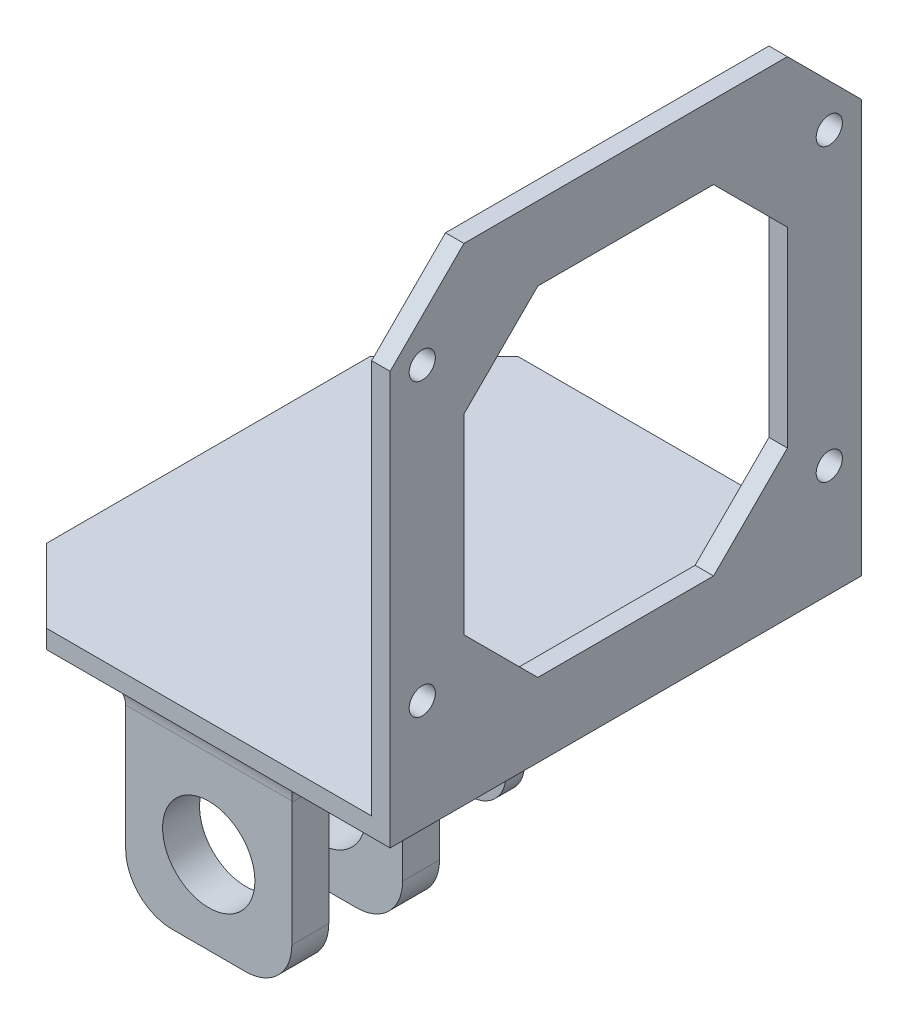
from build123d import *

# Parameters (mm, degrees)
SKETCH1_W            = 71.755
SKETCH1_H            = 81.026
BOSS_EXTRUDE1_DEPTH  = 3.175
BOSS_EXTRUDE4_DEPTH  = 80.51799999999999
BOSS_EXTRUDE10_START = -7.366
SKETCH8_R            = 3.174999999999998
BOSS_EXTRUDE10_DEPTH = 1.5875
FILLET1_R            = 6.35
FILLET2_R            = 8.466666666666665
CUT_EXTRUDE1_REACH   = 138.816
SKETCH9_W            = 55.626000000000005
SKETCH9_H            = 58.29299999999998
FILLET3_SIZE         = 12.7
CHAMFER1_SIZE        = 12.7
BOSS_EXTRUDE11_START = -11.03757
SKETCH10_R           = 7.937500000000002
BOSS_EXTRUDE11_DEPTH = 6.35
LPATTERN1_COUNT      = 2
LPATTERN1_PITCH      = 19.049999999999997
FILLET4_R            = 6.35
FILLET5_R            = 7.9375
CUT_EXTRUDE2_REACH   = 138.816
SKETCH13_R           = 2.2499999999999964
SKETCH13_R_2         = 2.2500000000000013


with BuildPart() as part:
    # Sketch1 → Boss-Extrude1 (new body)
    with BuildSketch(Plane(origin=(0, 0, 0), x_dir=(1, 0, 0), z_dir=(0, 1, 0))):
        with Locations((35.8775, 40.513)):
            Rectangle(SKETCH1_W, SKETCH1_H)
    extrude(amount=BOSS_EXTRUDE1_DEPTH)

    # Sketch3 → Boss-Extrude4 (add)
    with BuildSketch(Plane(origin=(0, 3.175, 0), x_dir=(1, 0, 0), z_dir=(0, 1, 0))):
        Polygon((71.755, 0), (68.58, -3.9e-16), (68.58, 81.026), (71.755, 81.026), align=None)
    extrude(amount=BOSS_EXTRUDE4_DEPTH)

    # Sketch8 → Boss-Extrude10 (add, symmetric)
    with BuildSketch(Plane.XY.offset(-40.513).offset(BOSS_EXTRUDE10_START)):
        Polygon((26.3525, 0), (26.352499999999996, -31.75), (45.4025, -31.75), (45.402499999999996, 0), align=None)
        with Locations((35.8775, -21.249999999999993)):
            Circle(SKETCH8_R, mode=Mode.SUBTRACT)
    extrude(amount=BOSS_EXTRUDE10_DEPTH, both=True)

    # Fillet1
    fillet1_edges = [part.edges().sort_by_distance(p)[0] for p in [
        (26.352499999999996, -31.75, -47.879),
        (45.4025, -31.75, -47.879),
    ]]
    fillet(fillet1_edges, radius=FILLET1_R)

    # Fillet2
    fillet2_edges = [part.edges().sort_by_distance(p)[0] for p in [
        (35.8775, 0, -49.466499999999996),
        (26.3525, 0, -47.879),
        (35.8775, 0, -46.2915),
        (45.402499999999996, 0, -47.879),
    ]]
    fillet(fillet2_edges, radius=FILLET2_R)

    # Sketch9 → Cut-Extrude1 (cut, up to next)
    with BuildSketch(Plane(origin=(71.755, 0, 0), x_dir=(0, 0, -1), z_dir=(1, 0, 0)), mode=Mode.PRIVATE) as cut_extrude1_sk1:
        with Locations((40.513000000000005, 41.84649999999999)):
            Rectangle(SKETCH9_W, SKETCH9_H)
    cut_extrude1_tool1 = extrude(cut_extrude1_sk1.sketch, amount=-CUT_EXTRUDE1_REACH, mode=Mode.PRIVATE) & part.part
    add(cut_extrude1_tool1.solids().sort_by_distance((71.755, 41.8465, -40.513))[0], mode=Mode.SUBTRACT)

    # Fillet3
    fillet3_edges = [part.edges().sort_by_distance(p)[0] for p in [
        (70.16749999999999, 83.69299999999998, -81.026),
        (70.16749999999999, 83.69299999999998, 1.9e-16),
        (0, 1.5875, -81.026),
        (0, 1.5875, 0),
    ]]
    chamfer(fillet3_edges, length=FILLET3_SIZE)

    # Chamfer1
    chamfer1_edges = [part.edges().sort_by_distance(p)[0] for p in [
        (70.16749999999999, 70.99299999999998, -12.700000000000003),
        (70.16749999999999, 70.99299999999998, -68.32600000000001),
        (70.16749999999999, 12.700000000000006, -68.32600000000001),
        (70.16749999999999, 12.700000000000006, -12.700000000000003),
    ]]
    chamfer(chamfer1_edges, length=CHAMFER1_SIZE)

    # Sketch10 → Boss-Extrude11 (add)
    with BuildSketch(Plane.XY.offset(BOSS_EXTRUDE11_START)):
        Polygon((21.589999999999996, 0), (21.59, -35.537499999999994), (50.165, -35.537499999999994), (50.165, 0), align=None)
        with Locations((35.8775, -21.249999999999993)):
            Circle(SKETCH10_R, mode=Mode.SUBTRACT)
    boss_extrude11 = extrude(amount=BOSS_EXTRUDE11_DEPTH)

    # LPattern1: Boss-Extrude11 ×2
    with Locations(*[(0, 0, -i * LPATTERN1_PITCH) for i in range(1, LPATTERN1_COUNT)]):
        add(boss_extrude11)

    # Fillet4
    # the kernel refuses this fillet: 6.35 mm, written as the material it adds along each edge
    with BuildSketch(Plane(origin=(50.165, 0, -4.687570000000001), x_dir=(0, 1.9e-16, 1), z_dir=(-1, 0, 0))) as fillet4_piece_1:
        with BuildLine():
            CenterArc((6.349999999999999, -6.128525637957305), FILLET4_R, 105.17689462009754, 74.82310537990246)
            Line((-1.16e-15, -6.1285256379573045), (-0.12700000000000095, -6.1285256379573045))
            Line((-0.12700000000000095, -6.1285256379573045), (-0.12699999999999978, 2e-17))
            Line((-0.12699999999999978, 2e-17), (2e-17, 0.127))
            ThreePointArc((2e-17, 0.127), (2.343784999999997, 0.12699999999999956), (4.654321400000001, 0.12257051275914613))
            Line((4.654321400000001, 0.12257051275914613), (4.687570000000001, 0))
        make_face()
    extrude(amount=28.575000000000003)
    with BuildSketch(Plane(origin=(50.165, 0, -26.912570000000006), x_dir=(1, 0, 0), z_dir=(0, 0, 1))) as fillet4_piece_2_section:
        with BuildLine():
            CenterArc((FILLET4_R, -FILLET4_R), FILLET4_R, 90, 90)
            Line((0, -FILLET4_R), (-FILLET4_R * 0.02, -FILLET4_R))
            Line((-FILLET4_R * 0.02, -FILLET4_R), (-FILLET4_R * 0.02, FILLET4_R * 0.02))
            Line((-FILLET4_R * 0.02, FILLET4_R * 0.02), (FILLET4_R, FILLET4_R * 0.02))
            Line((FILLET4_R, FILLET4_R * 0.02), (FILLET4_R, 0))
        make_face()
    fillet4_piece_2 = extrude(amount=22.225000000000005, mode=Mode.PRIVATE)
    fillet4_piece_2 = split(fillet4_piece_2, bisect_by=Plane(origin=(51.602608975594336, -1.437608975594344, -23.737569999999998), z_dir=(0, 0, -1)), keep=Keep.TOP, mode=Mode.PRIVATE)
    add(fillet4_piece_2)
    with BuildSketch(Plane(origin=(50.165, 0, -11.03757), x_dir=(1, 0, 0), z_dir=(0, 0, 1))) as fillet4_piece_3:
        with BuildLine():
            CenterArc((FILLET4_R, -FILLET4_R), FILLET4_R, 90, 90)
            Line((0, -FILLET4_R), (-FILLET4_R * 0.02, -FILLET4_R))
            Line((-FILLET4_R * 0.02, -FILLET4_R), (-FILLET4_R * 0.02, FILLET4_R * 0.02))
            Line((-FILLET4_R * 0.02, FILLET4_R * 0.02), (FILLET4_R, FILLET4_R * 0.02))
            Line((FILLET4_R, FILLET4_R * 0.02), (FILLET4_R, 0))
        make_face()
    extrude(amount=6.35)
    with BuildSketch(Plane(origin=(21.589999999999996, 0, -26.912569999999995), x_dir=(-1, 0, 0), z_dir=(0, 0, 1))) as fillet4_piece_4_section:
        with BuildLine():
            CenterArc((FILLET4_R, FILLET4_R), FILLET4_R, 180, 90)
            Line((0, FILLET4_R), (-FILLET4_R * 0.02, FILLET4_R))
            Line((-FILLET4_R * 0.02, FILLET4_R), (-FILLET4_R * 0.02, -FILLET4_R * 0.02))
            Line((-FILLET4_R * 0.02, -FILLET4_R * 0.02), (FILLET4_R, -FILLET4_R * 0.02))
            Line((FILLET4_R, -FILLET4_R * 0.02), (FILLET4_R, 0))
        make_face()
    fillet4_piece_4 = extrude(amount=22.224999999999994, mode=Mode.PRIVATE)
    fillet4_piece_4 = split(fillet4_piece_4, bisect_by=Plane(origin=(20.152391024405652, -1.4376089755943404, -23.737569999999998), z_dir=(0, 0, -1)), keep=Keep.TOP, mode=Mode.PRIVATE)
    add(fillet4_piece_4)
    with BuildSketch(Plane(origin=(21.589999999999996, 0, -11.03757), x_dir=(-1, 0, 0), z_dir=(0, 0, 1))) as fillet4_piece_5:
        with BuildLine():
            CenterArc((FILLET4_R, FILLET4_R), FILLET4_R, 180, 90)
            Line((0, FILLET4_R), (-FILLET4_R * 0.02, FILLET4_R))
            Line((-FILLET4_R * 0.02, FILLET4_R), (-FILLET4_R * 0.02, -FILLET4_R * 0.02))
            Line((-FILLET4_R * 0.02, -FILLET4_R * 0.02), (FILLET4_R, -FILLET4_R * 0.02))
            Line((FILLET4_R, -FILLET4_R * 0.02), (FILLET4_R, 0))
        make_face()
    extrude(amount=6.35)
    with BuildSketch(Plane(origin=(50.165, 0, -11.03757), x_dir=(0, 0, -1), z_dir=(-1, 0, 0))) as fillet4_piece_6:
        with BuildLine():
            CenterArc((FILLET4_R, FILLET4_R), FILLET4_R, 180, 90)
            Line((0, FILLET4_R), (-FILLET4_R * 0.02, FILLET4_R))
            Line((-FILLET4_R * 0.02, FILLET4_R), (-FILLET4_R * 0.02, -FILLET4_R * 0.02))
            Line((-FILLET4_R * 0.02, -FILLET4_R * 0.02), (FILLET4_R, -FILLET4_R * 0.02))
            Line((FILLET4_R, -FILLET4_R * 0.02), (FILLET4_R, 0))
        make_face()
    extrude(amount=28.575000000000003)
    with BuildSketch(Plane(origin=(50.165, 0, -23.737569999999998), x_dir=(0, 0, 1), z_dir=(-1, 0, 0))) as fillet4_piece_7:
        with BuildLine():
            CenterArc((FILLET4_R, -FILLET4_R), FILLET4_R, 90, 90)
            Line((0, -FILLET4_R), (-FILLET4_R * 0.02, -FILLET4_R))
            Line((-FILLET4_R * 0.02, -FILLET4_R), (-FILLET4_R * 0.02, FILLET4_R * 0.02))
            Line((-FILLET4_R * 0.02, FILLET4_R * 0.02), (FILLET4_R, FILLET4_R * 0.02))
            Line((FILLET4_R, FILLET4_R * 0.02), (FILLET4_R, 0))
        make_face()
    extrude(amount=28.575000000000003)
    with BuildSketch(Plane(origin=(50.165, 0, -30.08757), x_dir=(1, 0, 0), z_dir=(0, 0, 1))) as fillet4_piece_8:
        with BuildLine():
            CenterArc((FILLET4_R, -FILLET4_R), FILLET4_R, 90, 90)
            Line((0, -FILLET4_R), (-FILLET4_R * 0.02, -FILLET4_R))
            Line((-FILLET4_R * 0.02, -FILLET4_R), (-FILLET4_R * 0.02, FILLET4_R * 0.02))
            Line((-FILLET4_R * 0.02, FILLET4_R * 0.02), (FILLET4_R, FILLET4_R * 0.02))
            Line((FILLET4_R, FILLET4_R * 0.02), (FILLET4_R, 0))
        make_face()
    extrude(amount=6.350000000000001)
    with BuildSketch(Plane(origin=(50.165, 0, -30.08757), x_dir=(1, 0, 0), z_dir=(0, 0, 1))) as fillet4_piece_9_section:
        with BuildLine():
            CenterArc((FILLET4_R, -FILLET4_R), FILLET4_R, 90, 90)
            Line((0, -FILLET4_R), (-FILLET4_R * 0.02, -FILLET4_R))
            Line((-FILLET4_R * 0.02, -FILLET4_R), (-FILLET4_R * 0.02, FILLET4_R * 0.02))
            Line((-FILLET4_R * 0.02, FILLET4_R * 0.02), (FILLET4_R, FILLET4_R * 0.02))
            Line((FILLET4_R, FILLET4_R * 0.02), (FILLET4_R, 0))
        make_face()
    fillet4_piece_9 = extrude(amount=22.225, mode=Mode.PRIVATE)
    fillet4_piece_9 = split(fillet4_piece_9, bisect_by=Plane(origin=(51.602608975594336, -1.437608975594344, -11.03757), z_dir=(0, 0, 1)), keep=Keep.TOP, mode=Mode.PRIVATE)
    add(fillet4_piece_9)
    with BuildSketch(Plane(origin=(21.589999999999996, 0, -30.08757), x_dir=(-1, 0, 0), z_dir=(0, 0, 1))) as fillet4_piece_10:
        with BuildLine():
            CenterArc((FILLET4_R, FILLET4_R), FILLET4_R, 180, 90)
            Line((0, FILLET4_R), (-FILLET4_R * 0.02, FILLET4_R))
            Line((-FILLET4_R * 0.02, FILLET4_R), (-FILLET4_R * 0.02, -FILLET4_R * 0.02))
            Line((-FILLET4_R * 0.02, -FILLET4_R * 0.02), (FILLET4_R, -FILLET4_R * 0.02))
            Line((FILLET4_R, -FILLET4_R * 0.02), (FILLET4_R, 0))
        make_face()
    extrude(amount=6.350000000000001)
    with BuildSketch(Plane(origin=(21.589999999999996, 0, -30.08757), x_dir=(-1, 0, 0), z_dir=(0, 0, 1))) as fillet4_piece_11_section:
        with BuildLine():
            CenterArc((FILLET4_R, FILLET4_R), FILLET4_R, 180, 90)
            Line((0, FILLET4_R), (-FILLET4_R * 0.02, FILLET4_R))
            Line((-FILLET4_R * 0.02, FILLET4_R), (-FILLET4_R * 0.02, -FILLET4_R * 0.02))
            Line((-FILLET4_R * 0.02, -FILLET4_R * 0.02), (FILLET4_R, -FILLET4_R * 0.02))
            Line((FILLET4_R, -FILLET4_R * 0.02), (FILLET4_R, 0))
        make_face()
    fillet4_piece_11 = extrude(amount=22.224999999999994, mode=Mode.PRIVATE)
    fillet4_piece_11 = split(fillet4_piece_11, bisect_by=Plane(origin=(20.15239102440566, -1.4376089755943369, -11.03757), z_dir=(0, 0, 1)), keep=Keep.TOP, mode=Mode.PRIVATE)
    add(fillet4_piece_11)
    with BuildSketch(Plane(origin=(50.165, 0, -30.08757), x_dir=(0, 0, -1), z_dir=(-1, 0, 0))) as fillet4_piece_12:
        with BuildLine():
            CenterArc((FILLET4_R, FILLET4_R), FILLET4_R, 180, 90)
            Line((0, FILLET4_R), (-FILLET4_R * 0.02, FILLET4_R))
            Line((-FILLET4_R * 0.02, FILLET4_R), (-FILLET4_R * 0.02, -FILLET4_R * 0.02))
            Line((-FILLET4_R * 0.02, -FILLET4_R * 0.02), (FILLET4_R, -FILLET4_R * 0.02))
            Line((FILLET4_R, -FILLET4_R * 0.02), (FILLET4_R, 0))
        make_face()
    extrude(amount=28.575000000000003)
    with BuildSketch(Plane(origin=(65.48631409489326, 0, -4.687570000000001), x_dir=(0, 1.9e-16, 1), z_dir=(-1, 0, 0))) as fillet4_piece_13a_section:
        with BuildLine():
            CenterArc((6.349999999999999, -6.128525637957305), FILLET4_R, 105.17689462009754, 74.82310537990246)
            Line((-1.16e-15, -6.1285256379573045), (-0.12700000000000095, -6.1285256379573045))
            Line((-0.12700000000000095, -6.1285256379573045), (-0.12699999999999978, 2e-17))
            Line((-0.12699999999999978, 2e-17), (2e-17, 0.127))
            ThreePointArc((2e-17, 0.127), (2.343784999999997, 0.12699999999999956), (4.654321400000001, 0.12257051275914613))
            Line((4.654321400000001, 0.12257051275914613), (4.687570000000001, 0))
        make_face()
    fillet4_piece_13a = extrude(amount=43.89631409489326, mode=Mode.PRIVATE)
    fillet4_piece_13a = split(fillet4_piece_13a, bisect_by=Plane(origin=(50.165, -1.4475131983236835, -3.4994164368290797), z_dir=(1, 0, 0)), keep=Keep.TOP, mode=Mode.PRIVATE)
    with BuildSketch(Plane(origin=(50.165, 0, -11.03757), x_dir=(1, 0, 0), z_dir=(0, 0, 1))) as fillet4_piece_13b_section:
        with BuildLine():
            CenterArc((FILLET4_R, -FILLET4_R), FILLET4_R, 90, 90)
            Line((0, -FILLET4_R), (-FILLET4_R * 0.02, -FILLET4_R))
            Line((-FILLET4_R * 0.02, -FILLET4_R), (-FILLET4_R * 0.02, FILLET4_R * 0.02))
            Line((-FILLET4_R * 0.02, FILLET4_R * 0.02), (FILLET4_R, FILLET4_R * 0.02))
            Line((FILLET4_R, FILLET4_R * 0.02), (FILLET4_R, 0))
        make_face()
    fillet4_piece_13b = extrude(amount=22.225000000000005, mode=Mode.PRIVATE)
    fillet4_piece_13b = split(fillet4_piece_13b, bisect_by=Plane(origin=(51.60260897559435, -1.4376089755943449, 0), z_dir=(0, 0, -1)), keep=Keep.TOP, mode=Mode.PRIVATE)
    fillet4_piece_13b = split(fillet4_piece_13b, bisect_by=Plane(origin=(51.60260897559435, -1.437608975594344, -4.687570000000001), z_dir=(0, 0, 1)), keep=Keep.TOP, mode=Mode.PRIVATE)
    fillet4_piece_13 = fillet4_piece_13a & fillet4_piece_13b
    add(fillet4_piece_13)
    with BuildSketch(Plane(origin=(21.589999999999996, 0, -11.03757), x_dir=(-1, 0, 0), z_dir=(0, 0, 1))) as fillet4_piece_14a_section:
        with BuildLine():
            CenterArc((FILLET4_R, FILLET4_R), FILLET4_R, 180, 90)
            Line((0, FILLET4_R), (-FILLET4_R * 0.02, FILLET4_R))
            Line((-FILLET4_R * 0.02, FILLET4_R), (-FILLET4_R * 0.02, -FILLET4_R * 0.02))
            Line((-FILLET4_R * 0.02, -FILLET4_R * 0.02), (FILLET4_R, -FILLET4_R * 0.02))
            Line((FILLET4_R, -FILLET4_R * 0.02), (FILLET4_R, 0))
        make_face()
    fillet4_piece_14a = extrude(amount=22.224999999999994, mode=Mode.PRIVATE)
    fillet4_piece_14a = split(fillet4_piece_14a, bisect_by=Plane(origin=(20.152391024405656, -1.4376089755943378, 0), z_dir=(0, 0, -1)), keep=Keep.TOP, mode=Mode.PRIVATE)
    fillet4_piece_14a = split(fillet4_piece_14a, bisect_by=Plane(origin=(20.152391024405656, -1.4376089755943369, -4.687570000000001), z_dir=(0, 0, 1)), keep=Keep.TOP, mode=Mode.PRIVATE)
    with BuildSketch(Plane(origin=(50.165, 0, -4.687570000000001), x_dir=(0, 1.9e-16, 1), z_dir=(-1, 0, 0))) as fillet4_piece_14b_section:
        with BuildLine():
            CenterArc((6.349999999999999, -6.128525637957305), FILLET4_R, 105.17689462009754, 74.82310537990246)
            Line((-1.16e-15, -6.1285256379573045), (-0.12700000000000095, -6.1285256379573045))
            Line((-0.12700000000000095, -6.1285256379573045), (-0.12699999999999978, 2e-17))
            Line((-0.12699999999999978, 2e-17), (2e-17, 0.127))
            ThreePointArc((2e-17, 0.127), (2.343784999999997, 0.12699999999999956), (4.654321400000001, 0.12257051275914613))
            Line((4.654321400000001, 0.12257051275914613), (4.687570000000001, 0))
        make_face()
    fillet4_piece_14b = extrude(amount=43.896314094893256, mode=Mode.PRIVATE)
    fillet4_piece_14b = split(fillet4_piece_14b, bisect_by=Plane(origin=(12.225472193622682, -1.5171358944541156, -0.47452780637731795), z_dir=(0.7071067811865476, 0, -0.7071067811865476)), keep=Keep.TOP, mode=Mode.PRIVATE)
    fillet4_piece_14b = split(fillet4_piece_14b, bisect_by=Plane(origin=(21.589999999999996, -1.517135894454115, -3.59603707516942), z_dir=(-1, -1e-16, 0)), keep=Keep.TOP, mode=Mode.PRIVATE)
    fillet4_piece_14 = fillet4_piece_14a & fillet4_piece_14b
    add(fillet4_piece_14)
    with BuildSketch(Plane(origin=(66.03999999999999, 0, -11.037570000000002), x_dir=(0, 0, -1), z_dir=(-1, 0, 0))) as fillet4_piece_15a_section:
        with BuildLine():
            CenterArc((FILLET4_R, FILLET4_R), FILLET4_R, 180, 90)
            Line((-1.78e-15, FILLET4_R), (-FILLET4_R * 0.02, FILLET4_R))
            Line((-FILLET4_R * 0.02, FILLET4_R), (-FILLET4_R * 0.02, -FILLET4_R * 0.02))
            Line((-FILLET4_R * 0.02, -FILLET4_R * 0.02), (FILLET4_R, -FILLET4_R * 0.02))
            Line((FILLET4_R, -FILLET4_R * 0.02), (FILLET4_R, 0))
        make_face()
    fillet4_piece_15a = extrude(amount=44.449999999999996, mode=Mode.PRIVATE)
    fillet4_piece_15a = split(fillet4_piece_15a, bisect_by=Plane(origin=(50.165, -1.437608975594344, -12.475178975594343), z_dir=(1, 0, 0)), keep=Keep.TOP, mode=Mode.PRIVATE)
    with BuildSketch(Plane(origin=(50.165, 0, -26.912570000000006), x_dir=(1, 0, 0), z_dir=(0, 0, 1))) as fillet4_piece_15b_section:
        with BuildLine():
            CenterArc((FILLET4_R, -FILLET4_R), FILLET4_R, 90, 90)
            Line((0, -FILLET4_R), (-FILLET4_R * 0.02, -FILLET4_R))
            Line((-FILLET4_R * 0.02, -FILLET4_R), (-FILLET4_R * 0.02, FILLET4_R * 0.02))
            Line((-FILLET4_R * 0.02, FILLET4_R * 0.02), (FILLET4_R, FILLET4_R * 0.02))
            Line((FILLET4_R, FILLET4_R * 0.02), (FILLET4_R, 0))
        make_face()
    fillet4_piece_15b = extrude(amount=22.225000000000005, mode=Mode.PRIVATE)
    fillet4_piece_15b = split(fillet4_piece_15b, bisect_by=Plane(origin=(51.602608975594336, -1.437608975594344, -11.03757), z_dir=(0, 0, -1)), keep=Keep.TOP, mode=Mode.PRIVATE)
    fillet4_piece_15b = split(fillet4_piece_15b, bisect_by=Plane(origin=(51.602608975594336, -1.437608975594344, -23.737569999999998), z_dir=(0, 0, 1)), keep=Keep.TOP, mode=Mode.PRIVATE)
    fillet4_piece_15 = fillet4_piece_15a & fillet4_piece_15b
    add(fillet4_piece_15)
    with BuildSketch(Plane(origin=(21.589999999999996, 0, -26.912569999999995), x_dir=(-1, 0, 0), z_dir=(0, 0, 1))) as fillet4_piece_16a_section:
        with BuildLine():
            CenterArc((FILLET4_R, FILLET4_R), FILLET4_R, 180, 90)
            Line((0, FILLET4_R), (-FILLET4_R * 0.02, FILLET4_R))
            Line((-FILLET4_R * 0.02, FILLET4_R), (-FILLET4_R * 0.02, -FILLET4_R * 0.02))
            Line((-FILLET4_R * 0.02, -FILLET4_R * 0.02), (FILLET4_R, -FILLET4_R * 0.02))
            Line((FILLET4_R, -FILLET4_R * 0.02), (FILLET4_R, 0))
        make_face()
    fillet4_piece_16a = extrude(amount=22.224999999999994, mode=Mode.PRIVATE)
    fillet4_piece_16a = split(fillet4_piece_16a, bisect_by=Plane(origin=(20.152391024405656, -1.4376089755943404, -11.03757), z_dir=(0, 0, -1)), keep=Keep.TOP, mode=Mode.PRIVATE)
    fillet4_piece_16a = split(fillet4_piece_16a, bisect_by=Plane(origin=(20.152391024405656, -1.4376089755943404, -23.737569999999998), z_dir=(0, 0, 1)), keep=Keep.TOP, mode=Mode.PRIVATE)
    with BuildSketch(Plane(origin=(50.165, 0, -11.03757), x_dir=(0, 0, -1), z_dir=(-1, 0, 0))) as fillet4_piece_16b_section:
        with BuildLine():
            CenterArc((FILLET4_R, FILLET4_R), FILLET4_R, 180, 90)
            Line((0, FILLET4_R), (-FILLET4_R * 0.02, FILLET4_R))
            Line((-FILLET4_R * 0.02, FILLET4_R), (-FILLET4_R * 0.02, -FILLET4_R * 0.02))
            Line((-FILLET4_R * 0.02, -FILLET4_R * 0.02), (FILLET4_R, -FILLET4_R * 0.02))
            Line((FILLET4_R, -FILLET4_R * 0.02), (FILLET4_R, 0))
        make_face()
    fillet4_piece_16b = extrude(amount=44.449999999999996, mode=Mode.PRIVATE)
    fillet4_piece_16b = split(fillet4_piece_16b, bisect_by=Plane(origin=(21.589999999999996, -1.4376089755943406, -12.475178975594343), z_dir=(-1, -1e-16, 0)), keep=Keep.TOP, mode=Mode.PRIVATE)
    fillet4_piece_16 = fillet4_piece_16a & fillet4_piece_16b
    add(fillet4_piece_16)
    with BuildSketch(Plane(origin=(66.03999999999999, 0, -23.737569999999998), x_dir=(0, 0, 1), z_dir=(-1, 0, 0))) as fillet4_piece_17a_section:
        with BuildLine():
            CenterArc((FILLET4_R, -FILLET4_R), FILLET4_R, 90, 90)
            Line((0, -FILLET4_R), (-FILLET4_R * 0.02, -FILLET4_R))
            Line((-FILLET4_R * 0.02, -FILLET4_R), (-FILLET4_R * 0.02, FILLET4_R * 0.02))
            Line((-FILLET4_R * 0.02, FILLET4_R * 0.02), (FILLET4_R, FILLET4_R * 0.02))
            Line((FILLET4_R, FILLET4_R * 0.02), (FILLET4_R, 0))
        make_face()
    fillet4_piece_17a = extrude(amount=44.449999999999996, mode=Mode.PRIVATE)
    fillet4_piece_17a = split(fillet4_piece_17a, bisect_by=Plane(origin=(50.165, -1.4376089755943369, -22.299961024405654), z_dir=(1, 0, 0)), keep=Keep.TOP, mode=Mode.PRIVATE)
    with BuildSketch(Plane(origin=(50.165, 0, -30.08757), x_dir=(1, 0, 0), z_dir=(0, 0, 1))) as fillet4_piece_17b_section:
        with BuildLine():
            CenterArc((FILLET4_R, -FILLET4_R), FILLET4_R, 90, 90)
            Line((0, -FILLET4_R), (-FILLET4_R * 0.02, -FILLET4_R))
            Line((-FILLET4_R * 0.02, -FILLET4_R), (-FILLET4_R * 0.02, FILLET4_R * 0.02))
            Line((-FILLET4_R * 0.02, FILLET4_R * 0.02), (FILLET4_R, FILLET4_R * 0.02))
            Line((FILLET4_R, FILLET4_R * 0.02), (FILLET4_R, 0))
        make_face()
    fillet4_piece_17b = extrude(amount=22.225, mode=Mode.PRIVATE)
    fillet4_piece_17b = split(fillet4_piece_17b, bisect_by=Plane(origin=(51.60260897559434, -1.437608975594344, -11.03757), z_dir=(0, 0, -1)), keep=Keep.TOP, mode=Mode.PRIVATE)
    fillet4_piece_17b = split(fillet4_piece_17b, bisect_by=Plane(origin=(51.60260897559434, -1.437608975594344, -23.737569999999998), z_dir=(0, 0, 1)), keep=Keep.TOP, mode=Mode.PRIVATE)
    fillet4_piece_17 = fillet4_piece_17a & fillet4_piece_17b
    add(fillet4_piece_17)
    with BuildSketch(Plane(origin=(21.589999999999996, 0, -30.08757), x_dir=(-1, 0, 0), z_dir=(0, 0, 1))) as fillet4_piece_18a_section:
        with BuildLine():
            CenterArc((FILLET4_R, FILLET4_R), FILLET4_R, 180, 90)
            Line((0, FILLET4_R), (-FILLET4_R * 0.02, FILLET4_R))
            Line((-FILLET4_R * 0.02, FILLET4_R), (-FILLET4_R * 0.02, -FILLET4_R * 0.02))
            Line((-FILLET4_R * 0.02, -FILLET4_R * 0.02), (FILLET4_R, -FILLET4_R * 0.02))
            Line((FILLET4_R, -FILLET4_R * 0.02), (FILLET4_R, 0))
        make_face()
    fillet4_piece_18a = extrude(amount=22.224999999999994, mode=Mode.PRIVATE)
    fillet4_piece_18a = split(fillet4_piece_18a, bisect_by=Plane(origin=(20.152391024405656, -1.4376089755943404, -11.03757), z_dir=(0, 0, -1)), keep=Keep.TOP, mode=Mode.PRIVATE)
    fillet4_piece_18a = split(fillet4_piece_18a, bisect_by=Plane(origin=(20.152391024405656, -1.4376089755943404, -23.737569999999998), z_dir=(0, 0, 1)), keep=Keep.TOP, mode=Mode.PRIVATE)
    with BuildSketch(Plane(origin=(50.165, 0, -23.737569999999998), x_dir=(0, 0, 1), z_dir=(-1, 0, 0))) as fillet4_piece_18b_section:
        with BuildLine():
            CenterArc((FILLET4_R, -FILLET4_R), FILLET4_R, 90, 90)
            Line((0, -FILLET4_R), (-FILLET4_R * 0.02, -FILLET4_R))
            Line((-FILLET4_R * 0.02, -FILLET4_R), (-FILLET4_R * 0.02, FILLET4_R * 0.02))
            Line((-FILLET4_R * 0.02, FILLET4_R * 0.02), (FILLET4_R, FILLET4_R * 0.02))
            Line((FILLET4_R, FILLET4_R * 0.02), (FILLET4_R, 0))
        make_face()
    fillet4_piece_18b = extrude(amount=44.449999999999996, mode=Mode.PRIVATE)
    fillet4_piece_18b = split(fillet4_piece_18b, bisect_by=Plane(origin=(21.589999999999996, -1.4376089755943362, -22.299961024405654), z_dir=(-1, -1e-16, 0)), keep=Keep.TOP, mode=Mode.PRIVATE)
    fillet4_piece_18 = fillet4_piece_18a & fillet4_piece_18b
    add(fillet4_piece_18)
    with BuildSketch(Plane(origin=(50.165, 0, -45.96257), x_dir=(1, 0, 0), z_dir=(0, 0, 1))) as fillet4_piece_19a_section:
        with BuildLine():
            CenterArc((FILLET4_R, -FILLET4_R), FILLET4_R, 90, 90)
            Line((0, -FILLET4_R), (-FILLET4_R * 0.02, -FILLET4_R))
            Line((-FILLET4_R * 0.02, -FILLET4_R), (-FILLET4_R * 0.02, FILLET4_R * 0.02))
            Line((-FILLET4_R * 0.02, FILLET4_R * 0.02), (FILLET4_R, FILLET4_R * 0.02))
            Line((FILLET4_R, FILLET4_R * 0.02), (FILLET4_R, 0))
        make_face()
    fillet4_piece_19a = extrude(amount=22.225, mode=Mode.PRIVATE)
    fillet4_piece_19a = split(fillet4_piece_19a, bisect_by=Plane(origin=(51.60260897559434, -1.437608975594344, -30.08757), z_dir=(0, 0, -1)), keep=Keep.TOP, mode=Mode.PRIVATE)
    with BuildSketch(Plane(origin=(66.04, 0, -30.08757), x_dir=(0, 0, -1), z_dir=(-1, 0, 0))) as fillet4_piece_19b_section:
        with BuildLine():
            CenterArc((FILLET4_R, FILLET4_R), FILLET4_R, 180, 90)
            Line((0, FILLET4_R), (-FILLET4_R * 0.02, FILLET4_R))
            Line((-FILLET4_R * 0.02, FILLET4_R), (-FILLET4_R * 0.02, -FILLET4_R * 0.02))
            Line((-FILLET4_R * 0.02, -FILLET4_R * 0.02), (FILLET4_R, -FILLET4_R * 0.02))
            Line((FILLET4_R, -FILLET4_R * 0.02), (FILLET4_R, 0))
        make_face()
    fillet4_piece_19b = extrude(amount=44.45000000000001, mode=Mode.PRIVATE)
    fillet4_piece_19b = split(fillet4_piece_19b, bisect_by=Plane(origin=(50.165, -1.437608975594344, -31.525178975594343), z_dir=(1, 0, 0)), keep=Keep.TOP, mode=Mode.PRIVATE)
    fillet4_piece_19 = fillet4_piece_19a & fillet4_piece_19b
    add(fillet4_piece_19)
    with BuildSketch(Plane(origin=(21.589999999999996, 0, -45.962569999999985), x_dir=(-1, 0, 0), z_dir=(0, 0, 1))) as fillet4_piece_20a_section:
        with BuildLine():
            CenterArc((FILLET4_R, FILLET4_R), FILLET4_R, 180, 90)
            Line((0, FILLET4_R), (-FILLET4_R * 0.02, FILLET4_R))
            Line((-FILLET4_R * 0.02, FILLET4_R), (-FILLET4_R * 0.02, -FILLET4_R * 0.02))
            Line((-FILLET4_R * 0.02, -FILLET4_R * 0.02), (FILLET4_R, -FILLET4_R * 0.02))
            Line((FILLET4_R, -FILLET4_R * 0.02), (FILLET4_R, 0))
        make_face()
    fillet4_piece_20a = extrude(amount=22.224999999999987, mode=Mode.PRIVATE)
    fillet4_piece_20a = split(fillet4_piece_20a, bisect_by=Plane(origin=(20.152391024405656, -1.4376089755943404, -30.08757), z_dir=(0, 0, -1)), keep=Keep.TOP, mode=Mode.PRIVATE)
    with BuildSketch(Plane(origin=(50.165, 0, -30.08757), x_dir=(0, 0, -1), z_dir=(-1, 0, 0))) as fillet4_piece_20b_section:
        with BuildLine():
            CenterArc((FILLET4_R, FILLET4_R), FILLET4_R, 180, 90)
            Line((0, FILLET4_R), (-FILLET4_R * 0.02, FILLET4_R))
            Line((-FILLET4_R * 0.02, FILLET4_R), (-FILLET4_R * 0.02, -FILLET4_R * 0.02))
            Line((-FILLET4_R * 0.02, -FILLET4_R * 0.02), (FILLET4_R, -FILLET4_R * 0.02))
            Line((FILLET4_R, -FILLET4_R * 0.02), (FILLET4_R, 0))
        make_face()
    fillet4_piece_20b = extrude(amount=44.45, mode=Mode.PRIVATE)
    fillet4_piece_20b = split(fillet4_piece_20b, bisect_by=Plane(origin=(21.589999999999996, -1.4376089755943398, -31.52517897559434), z_dir=(-1, -1e-16, 0)), keep=Keep.TOP, mode=Mode.PRIVATE)
    fillet4_piece_20 = fillet4_piece_20a & fillet4_piece_20b
    add(fillet4_piece_20)

    # Fillet5
    fillet5_edges = [part.edges().sort_by_distance(p)[0] for p in [
        (50.165, -35.537499999999994, -7.862570000000001),
        (21.59, -35.537499999999994, -7.862570000000001),
        (50.165, -35.537499999999994, -26.91257),
        (21.59, -35.537499999999994, -26.91257),
    ]]
    fillet(fillet5_edges, radius=FILLET5_R)

    # Sketch13 → Cut-Extrude2 (cut, up to next)
    with BuildSketch(Plane(origin=(71.755, 0, 0), x_dir=(0, 0, -1), z_dir=(1, 0, 0)), mode=Mode.PRIVATE) as cut_extrude2_sk1:
        with Locations((75.52599999999997, 69.17499999999998)):
            Circle(SKETCH13_R)
    cut_extrude2_tool1 = extrude(cut_extrude2_sk1.sketch, amount=-CUT_EXTRUDE2_REACH, mode=Mode.PRIVATE) & part.part
    # Sketch13 → Cut-Extrude2 (cut, up to next)
    with BuildSketch(Plane(origin=(71.755, 0, 0), x_dir=(0, 0, -1), z_dir=(1, 0, 0)), mode=Mode.PRIVATE) as cut_extrude2_sk2:
        with Locations((5.525999999999962, 69.175)):
            Circle(SKETCH13_R_2)
    cut_extrude2_tool2 = extrude(cut_extrude2_sk2.sketch, amount=-CUT_EXTRUDE2_REACH, mode=Mode.PRIVATE) & part.part
    # Sketch13 → Cut-Extrude2 (cut, up to next)
    with BuildSketch(Plane(origin=(71.755, 0, 0), x_dir=(0, 0, -1), z_dir=(1, 0, 0)), mode=Mode.PRIVATE) as cut_extrude2_sk3:
        with Locations((5.525999999999962, 19.17499999999998)):
            Circle(SKETCH13_R_2)
    cut_extrude2_tool3 = extrude(cut_extrude2_sk3.sketch, amount=-CUT_EXTRUDE2_REACH, mode=Mode.PRIVATE) & part.part
    # Sketch13 → Cut-Extrude2 (cut, up to next)
    with BuildSketch(Plane(origin=(71.755, 0, 0), x_dir=(0, 0, -1), z_dir=(1, 0, 0)), mode=Mode.PRIVATE) as cut_extrude2_sk4:
        with Locations((75.52599999999997, 19.174999999999972)):
            Circle(SKETCH13_R)
    cut_extrude2_tool4 = extrude(cut_extrude2_sk4.sketch, amount=-CUT_EXTRUDE2_REACH, mode=Mode.PRIVATE) & part.part
    add(cut_extrude2_tool1.solids().sort_by_distance((71.755, 69.175, -75.526))[0], mode=Mode.SUBTRACT)
    add(cut_extrude2_tool2.solids().sort_by_distance((71.755, 69.175, -5.526))[0], mode=Mode.SUBTRACT)
    add(cut_extrude2_tool3.solids().sort_by_distance((71.755, 19.175, -5.526))[0], mode=Mode.SUBTRACT)
    add(cut_extrude2_tool4.solids().sort_by_distance((71.755, 19.175, -75.526))[0], mode=Mode.SUBTRACT)


solid = part.part
